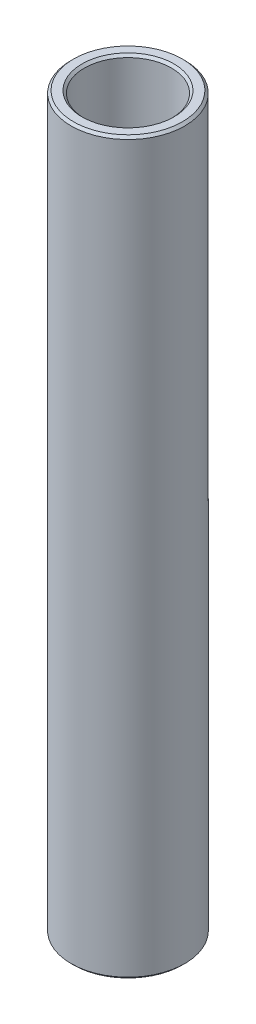
from build123d import *

# Parameters (mm, degrees)
SKETCH1_W     = 0.7
SKETCH1_H     = 38.55
CHAMFER1_SIZE = 0.127


with BuildPart() as part:
    # Sketch1 → Revolve1 (revolve)
    with BuildSketch(Plane.XY):
        with Locations((2.65, 0)):
            Rectangle(SKETCH1_W, SKETCH1_H)
    revolve(axis=Axis((0, 12.831952247, 0), (0, -1, 0)))

    # Chamfer1
    chamfer1_edges = [part.edges().sort_by_distance(p)[0] for p in [
        (-2.3, -19.275, 0),
        (-3, -19.275, 0),
        (-3, 19.275, 0),
        (-2.3, 19.275, 0),
    ]]
    chamfer(chamfer1_edges, length=CHAMFER1_SIZE)


solid = part.part
